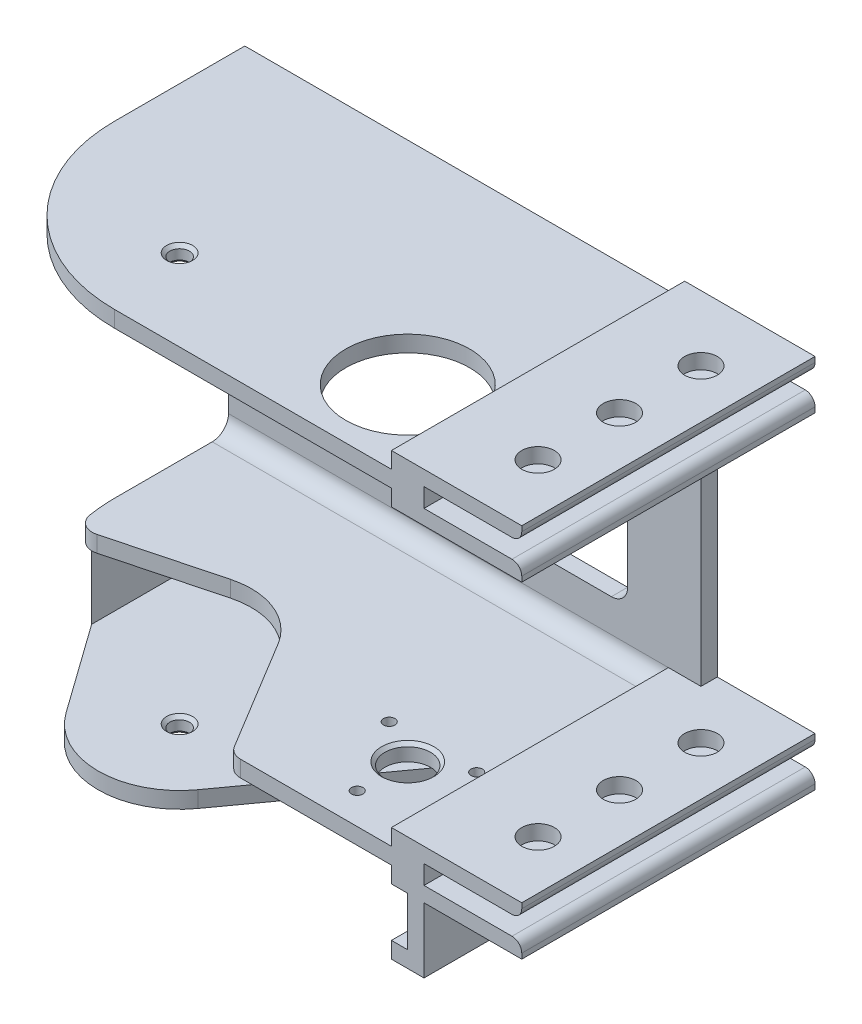
from build123d import *

# Parameters (mm, degrees)
SKETCH_1_W               = 145
SKETCH_1_H               = 5
EXTRUDE_1_DEPTH          = 5
SKETCH_1_3_W             = 145
SKETCH_1_3_H             = 5
EXTRUDE_2_DEPTH          = 85
SKETCH_2_W               = 30
SKETCH_2_H               = 5.8
CUT_EXTRUDE_1_DEPTH      = 130
SKETCH_3_R               = 3
CUT_EXTRUDE_2_DEPTH      = 188
SKETCH_4_R               = 22
CUT_EXTRUDE_3_DEPTH      = 10
CUT_EXTRUDE_4_DEPTH      = 10
SKETCH_6_R               = 7
SKETCH_6_R_2             = 1.75
CUT_EXTRUDE_5_DEPTH      = 10
SKETCH_7_R               = 3.5
CUT_EXTRUDE_6_DEPTH      = 1.5
CUT_EXTRUDE_7_REACH      = 191.764
FILLET_2_R               = 50
FILLET_3_R               = 30
SKETCH_9_R               = 19
CUT_EXTRUDE_8_DEPTH      = 9.5
FILLET_4_R               = 3
SKETCH_10_W              = 100
SKETCH_10_H              = 65
SKETCH_10_H_2            = 10
CUT_EXTRUDE_9_DEPTH      = 9.5
CUT_EXTRUDE_START        = -52.6
CUT_EXTRUDE_10_DEPTH     = 5
FILLET_5_R               = 5
FILLET_6_R               = 5
FILLET_7_R               = 5
CUT_EXTRUDE_START_2      = -57.6
CUT_EXTRUDE_11_OUTLINE_R = 5
CUT_EXTRUDE_11_DEPTH     = 115.2
CHAMFER_1_SIZE           = 1


# Read off the part's stored shape, not the designer's step: 컷-돌출10, 컷-돌출11
# Some blends are built 0.0001 mm under size
with BuildPart() as part:
    # 스케치1 → 보스-돌출1 (new body)
    with BuildSketch(Plane.XY):
        with Locations((0, 50.1)):
            Rectangle(SKETCH_1_W, SKETCH_1_H)
        Polygon((-12.5, -47.6), (62.5, -47.6), (62.5, -42.6), (72.5, -42.6), (72.5, 42.6), (62.5, 42.6), (62.5, 47.6), (-72.5, 47.6), (-72.5, -47.6), (-67.5, -47.6), (-52.5, -47.6), align=None)
        Polygon((72.5, -47.6), (67.5, -47.6), (62.5, -47.6), (-12.5, -47.6), (-52.5, -47.6), (-67.5, -47.6), (-72.5, -47.6), (-72.5, -77.6), (-67.5, -77.6), (67.5, -77.6), (72.5, -77.6), (72.5, -57.6), (67.5, -57.6), (67.5, -72.6), (-67.5, -72.6), (-67.5, -52.6), (62.5, -52.6), (67.5, -52.6), (72.5, -52.6), align=None)
        Polygon((62.5, -57.6), (62.5, -52.6), (-67.5, -52.6), (-67.5, -72.6), (67.5, -72.6), (67.5, -57.6), align=None)
        Polygon((62.5, 42.6), (72.5, 42.6), (102.5, 42.6), (102.5, 47.6), (72.5, 47.6), (62.5, 47.6), align=None)
        Polygon((62.5, 57.6), (62.5, 52.6), (72.5, 52.6), (102.5, 52.6), (102.5, 57.6), align=None)
        Polygon((62.5, -47.6), (67.5, -47.6), (72.5, -47.6), (102.5, -47.6), (102.5, -42.6), (72.5, -42.6), (62.5, -42.6), align=None)
        Polygon((102.5, -52.6), (72.5, -52.6), (67.5, -52.6), (62.5, -52.6), (62.5, -57.6), (67.5, -57.6), (72.5, -57.6), (102.5, -57.6), align=None)
    extrude(amount=-EXTRUDE_1_DEPTH)

    # 스케치1<3> → 보스-돌출2 (add)
    with BuildSketch(Plane.XY):
        with Locations((0, 50.1)):
            Rectangle(SKETCH_1_3_W, SKETCH_1_3_H)
        Polygon((72.5, -47.6), (67.5, -47.6), (62.5, -47.6), (-12.5, -47.6), (-52.5, -47.6), (-67.5, -47.6), (-72.5, -47.6), (-72.5, -77.6), (-67.5, -77.6), (67.5, -77.6), (72.5, -77.6), (72.5, -57.6), (67.5, -57.6), (67.5, -72.6), (-67.5, -72.6), (-67.5, -52.6), (62.5, -52.6), (67.5, -52.6), (72.5, -52.6), align=None)
        Polygon((102.5, -52.6), (72.5, -52.6), (67.5, -52.6), (62.5, -52.6), (62.5, -57.6), (67.5, -57.6), (72.5, -57.6), (102.5, -57.6), align=None)
        Polygon((62.5, -47.6), (67.5, -47.6), (72.5, -47.6), (102.5, -47.6), (102.5, -42.6), (72.5, -42.6), (62.5, -42.6), align=None)
        Polygon((62.5, 42.6), (72.5, 42.6), (102.5, 42.6), (102.5, 47.6), (72.5, 47.6), (62.5, 47.6), align=None)
        Polygon((62.5, 57.6), (62.5, 52.6), (72.5, 52.6), (102.5, 52.6), (102.5, 57.6), align=None)
    extrude(amount=EXTRUDE_2_DEPTH)

    # 스케치2 → 컷-돌출1 (cut)
    with BuildSketch(Plane.XY.offset(85)):
        with Locations((87.5, -50.1)):
            Rectangle(SKETCH_2_W, SKETCH_2_H)
        with Locations((87.5, 50.1)):
            Rectangle(SKETCH_2_W, SKETCH_2_H)
    extrude(amount=-CUT_EXTRUDE_1_DEPTH, mode=Mode.SUBTRACT)

    # 스케치3 → 컷-돌출2 (cut)
    with BuildSketch(Plane.XZ.offset(77.6)):
        with Locations(Location((-27.5, 60, 0), (0, 0, 270))):
            Circle(SKETCH_3_R)
        with Locations(Location((42.5, 60, 0), (0, 0, 270))):
            Circle(SKETCH_3_R)
    extrude(amount=-CUT_EXTRUDE_2_DEPTH, mode=Mode.SUBTRACT)

    # 스케치4 → 컷-돌출3 (cut)
    with BuildSketch(Plane(origin=(0, -47.6, 0), x_dir=(1, 0, 0), z_dir=(0, 1, 0))):
        with Locations(Location((-27.5, -60, 0), (0, 0, 270))):
            Circle(SKETCH_4_R)
    extrude(amount=-CUT_EXTRUDE_3_DEPTH, mode=Mode.SUBTRACT)

    # 스케치5 → 컷-돌출4 (cut)
    with BuildSketch(Plane.XZ.offset(77.6)):
        with BuildLine():
            Line((22.5, 40), (22.5, 143.403110926))
            ThreePointArc((22.5, 143.403110926), (42.5, 163.403110926), (62.5, 143.403110926))
            Line((62.5, 143.403110926), (62.5, 40))
            ThreePointArc((62.5, 40), (42.5, 20), (22.5, 40))
        make_face()
    extrude(amount=-CUT_EXTRUDE_4_DEPTH, mode=Mode.SUBTRACT)

    # 스케치6 → 컷-돌출5 (cut)
    with BuildSketch(Plane.XZ.offset(52.6)):
        with Locations(Location((42.5, 60, 0), (0, 0, 270))):
            Circle(SKETCH_6_R)
        with Locations(Location((42.5, 75.5, 0), (0, 0, 270))):
            Circle(SKETCH_6_R_2)
        with Locations(Location((55.923393759, 52.25, 0), (0, 0, 270))):
            Circle(SKETCH_6_R_2)
        with Locations(Location((29.076606241, 52.25, 0), (0, 0, 270))):
            Circle(SKETCH_6_R_2)
    extrude(amount=-CUT_EXTRUDE_5_DEPTH, mode=Mode.SUBTRACT)

    # 스케치7 → 컷-돌출6 (cut)
    with BuildSketch(Plane.XZ.offset(52.6)):
        with Locations(Location((42.5, 75.5, 0), (0, 0, 270))):
            Circle(SKETCH_7_R)
        with Locations(Location((29.076606241, 52.25, 0), (0, 0, 270))):
            Circle(SKETCH_7_R)
        with Locations(Location((55.923393759, 52.25, 0), (0, 0, 270))):
            Circle(SKETCH_7_R)
    extrude(amount=-CUT_EXTRUDE_6_DEPTH, mode=Mode.SUBTRACT)

    # 컷-돌출7: up to this face of the body (flat: up to its plane)
    cut_extrude_7_end = Plane(part.part.faces().sort_by_distance((0.295943146, -52.6, 39.117345593))[0])
    # 스케치8 → 컷-돌출7 (cut, up to the picked face)
    with BuildSketch(Plane.XZ.offset(77.6), mode=Mode.PRIVATE) as cut_extrude_7_sk1:
        with BuildLine():
            ThreePointArc((-47.845650901, 74.527714528), (-38.941309623, 82.228280053), (-27.499999753, 85))
            Line((-27.499999753, 85), (-72.5, 85))
            Line((-72.5, 85), (-72.5, 40))
            Line((-72.5, 40), (-47.845650901, 74.527714528))
        make_face()
    cut_extrude_7_tool1 = split(extrude(cut_extrude_7_sk1.sketch, amount=-CUT_EXTRUDE_7_REACH, mode=Mode.PRIVATE), bisect_by=cut_extrude_7_end, keep=Keep.BOTH, mode=Mode.PRIVATE)
    # 스케치8 → 컷-돌출7 (cut, up to the picked face)
    with BuildSketch(Plane.XZ.offset(77.6), mode=Mode.PRIVATE) as cut_extrude_7_sk2:
        with BuildLine():
            ThreePointArc((-27.499999753, 85), (-16.126031711, 82.26281306), (-7.242677763, 74.650627829))
            Line((-7.242677763, 74.650627829), (26.29414221, 28.279497737))
            ThreePointArc((26.29414221, 28.279497737), (23.472163079, 33.840339124), (22.5, 40))
            Line((22.5, 40), (22.5, 85))
            Line((22.5, 85), (-27.499999753, 85))
        make_face()
    cut_extrude_7_tool2 = split(extrude(cut_extrude_7_sk2.sketch, amount=-CUT_EXTRUDE_7_REACH, mode=Mode.PRIVATE), bisect_by=cut_extrude_7_end, keep=Keep.BOTH, mode=Mode.PRIVATE)
    add(cut_extrude_7_tool1.solids().sort_by(Axis((-61.047418, -77.6, 70.421968), (0, 1, 0)))[0], mode=Mode.SUBTRACT)
    add(cut_extrude_7_tool2.solids().sort_by(Axis((9.51437, -77.6, 68.061513), (0, 1, 0)))[0], mode=Mode.SUBTRACT)

    # 필렛2
    # the kernel refuses this fillet: 50 mm, written as the material it takes off along each edge
    with BuildSketch(Plane(origin=(-72.5, 77.4, 85), x_dir=(1, 0, 0), z_dir=(0, -1, 0))) as fillet_2_piece_1_section:
        with BuildLine():
            CenterArc((FILLET_2_R, -FILLET_2_R), FILLET_2_R, 90, 90)
            Line((0, -FILLET_2_R), (0, 0))
            Line((0, 0), (FILLET_2_R, 0))
        make_face()
    fillet_2_piece_1 = extrude(amount=255, mode=Mode.PRIVATE)
    fillet_2_piece_1 = split(fillet_2_piece_1, bisect_by=Plane(origin=(-25.214622506, -72.6, 84.974238143), z_dir=(0, 1, 0)), keep=Keep.TOP, mode=Mode.PRIVATE)
    add(fillet_2_piece_1, mode=Mode.SUBTRACT)
    with BuildSketch(Plane(origin=(-72.5, 77.4, 85), x_dir=(1, 0, 0), z_dir=(0, -1, 0))) as fillet_2_piece_2_section:
        with BuildLine():
            CenterArc((FILLET_2_R, -FILLET_2_R), FILLET_2_R, 90, 90)
            Line((0, -FILLET_2_R), (0, 0))
            Line((0, 0), (FILLET_2_R, 0))
        make_face()
    fillet_2_piece_2 = extrude(amount=255, mode=Mode.PRIVATE)
    fillet_2_piece_2 = fillet_2_piece_2 - Plane(origin=(-27.5, -75.1, 60), x_dir=(-0.8138260360510762, 0, 0.5811085811149175), z_dir=(0, -1, 0)) * Cylinder(25, 710, mode=Mode.PRIVATE)
    add(fillet_2_piece_2, mode=Mode.SUBTRACT)
    with BuildSketch(Plane(origin=(-72.5, 177.6, 85), x_dir=(1, 0, 0), z_dir=(0, -1, 0))) as fillet_2_piece_3_section:
        with BuildLine():
            CenterArc((FILLET_2_R, -FILLET_2_R), FILLET_2_R, 90, 90)
            Line((0, -FILLET_2_R), (0, 0))
            Line((0, 0), (FILLET_2_R, 0))
        make_face()
    fillet_2_piece_3 = extrude(amount=255, mode=Mode.PRIVATE)
    fillet_2_piece_3 = split(fillet_2_piece_3, bisect_by=Plane(origin=(-25.214622506, -72.6, 84.974238143), z_dir=(0, 1, 0)), keep=Keep.TOP, mode=Mode.PRIVATE)
    add(fillet_2_piece_3, mode=Mode.SUBTRACT)
    with BuildSketch(Plane(origin=(-72.5, 177.6, 85), x_dir=(1, 0, 0), z_dir=(0, -1, 0))) as fillet_2_piece_4_section:
        with BuildLine():
            CenterArc((FILLET_2_R, -FILLET_2_R), FILLET_2_R, 90, 90)
            Line((0, -FILLET_2_R), (0, 0))
            Line((0, 0), (FILLET_2_R, 0))
        make_face()
    fillet_2_piece_4 = extrude(amount=255, mode=Mode.PRIVATE)
    fillet_2_piece_4 = fillet_2_piece_4 - Plane(origin=(-27.5, -75, 60), x_dir=(-0.8138260360510762, 0, 0.5811085811149175), z_dir=(0, -1, 0)) * Cylinder(25, 711, mode=Mode.PRIVATE)
    add(fillet_2_piece_4, mode=Mode.SUBTRACT)

    # 필렛3
    # the kernel refuses this fillet: 30 mm, written as the material it takes off along each edge
    with BuildSketch(Plane(origin=(-72.206316289, -102.667286914, 40.411295682), x_dir=(-0.02928953897297379, 0, -0.999570969419756), z_dir=(0, 1, 0))) as fillet_3_piece_1:
        with BuildLine():
            CenterArc((9.148228596, -29.987129083), FILLET_3_R, 88.321592997, 35.528552159)
            Line((-7.562451754, -5.072210616), (-9.23351979, -2.580718769))
            Line((-9.23351979, -2.580718769), (-1.671068035, 2.491491847))
            Line((-1.671068035, 2.491491847), (-0.237185939, 2.990609107))
            ThreePointArc((-0.237185939, 2.990609107), (5.505444548, 3.133776264), (10.114783383, 2.998712908))
            Line((10.114783383, 2.998712908), (10.026914766, 0))
        make_face()
    extrude(amount=50.067286914, mode=Mode.SUBTRACT)

    # 스케치9 → 컷-돌출8 (cut)
    with BuildSketch(Plane(origin=(0, 52.6, 0), x_dir=(1, 0, 0), z_dir=(0, 1, 0))):
        with Locations(Location((42.5, -60, 0), (0, 0, 270))):
            Circle(SKETCH_9_R)
    extrude(amount=-CUT_EXTRUDE_8_DEPTH, mode=Mode.SUBTRACT)

    # 필렛4
    fillet_4_edges = [part.edges().sort_by_distance(p)[0] for p in [
        (102.5, -47.2, 40),
        (102.5, -53, 40),
        (102.5, 53, 40),
        (102.5, 47.2, 40),
    ]]
    fillet(fillet_4_edges, radius=FILLET_4_R)

    # 스케치10 → 컷-돌출9 (cut)
    with BuildSketch(Plane.XY):
        Rectangle(SKETCH_10_W, SKETCH_10_H)
        with Locations((0, -63.6)):
            Rectangle(SKETCH_10_W, SKETCH_10_H_2)
    extrude(amount=-CUT_EXTRUDE_9_DEPTH, mode=Mode.SUBTRACT)

    # 컷-돌출10 outline → 컷-돌출10 (cut)
    with BuildSketch(Plane(origin=(0, 0, 0), x_dir=(1, 0, 0), z_dir=(0, 1, 0)).offset(CUT_EXTRUDE_START)):
        with BuildLine():
            ThreePointArc((-8.678958263, -48.608407139), (-35.751039768, -80.394125202), (-33.105237637, -38.726041482))
            Line((-33.105237637, -38.726041482), (-70.612485439, -48.608407139))
            ThreePointArc((-70.612485439, -48.608407139), (-52.662722382, -74.877439467), (-22.5, -85))
            Line((-22.5, -85), (13.347357562, -85))
            Line((13.347357562, -85), (-8.678958263, -48.608407139))
        make_face()
    extrude(amount=CUT_EXTRUDE_10_DEPTH, mode=Mode.SUBTRACT)

    # 필렛5
    fillet_5_edges = [part.edges().sort_by_distance(p)[0] for p in [
        (-70.612485439, -50.1, 48.608407139),
        (13.347357562, -50.1, 85),
    ]]
    fillet(fillet_5_edges, radius=FILLET_5_R)

    # 필렛6
    fillet_6_edges = [part.edges().sort_by_distance(p)[0] for p in [
        (50, 32.5, -2.5),
        (50, -32.5, -2.5),
        (-50, -32.5, -2.5),
        (-50, 32.5, -2.5),
        (50, -58.6, -2.5),
        (50, -68.6, -2.5),
        (-50, -68.6, -2.5),
        (-50, -58.6, -2.5),
    ]]
    fillet(fillet_6_edges, radius=FILLET_6_R - 0.0001)  # a hair under: the kernel refuses the full size

    # 필렛7
    fillet_7_edges = [part.edges().sort_by_distance(p)[0] for p in [
        (-5, -47.6, 0),
        (-5, 47.6, 0),
    ]]
    fillet(fillet_7_edges, radius=FILLET_7_R)

    # 컷-돌출11 outline → 컷-돌출11 (cut)
    with BuildSketch(Plane(origin=(0, 0, 0), x_dir=(1, 0, 0), z_dir=(0, 1, 0)).offset(CUT_EXTRUDE_START_2)):
        with Locations((87.5, -15)):
            Circle(CUT_EXTRUDE_11_OUTLINE_R)
        with Locations((87.5, -40)):
            Circle(CUT_EXTRUDE_11_OUTLINE_R)
        with Locations((87.5, -65)):
            Circle(CUT_EXTRUDE_11_OUTLINE_R)
    extrude(amount=CUT_EXTRUDE_11_DEPTH, mode=Mode.SUBTRACT)

    # 모따기1
    chamfer_1_edges = [part.edges().sort_by_distance(p)[0] for p in [
        (-27.5, 52.6, 63),
        (-27.5, -72.6, 63),
        (-27.5, 47.6, 63),
        (-27.5, -77.6, 63),
        (42.5, -47.6, 67),
    ]]
    chamfer(chamfer_1_edges, length=CHAMFER_1_SIZE)


solid = part.part
